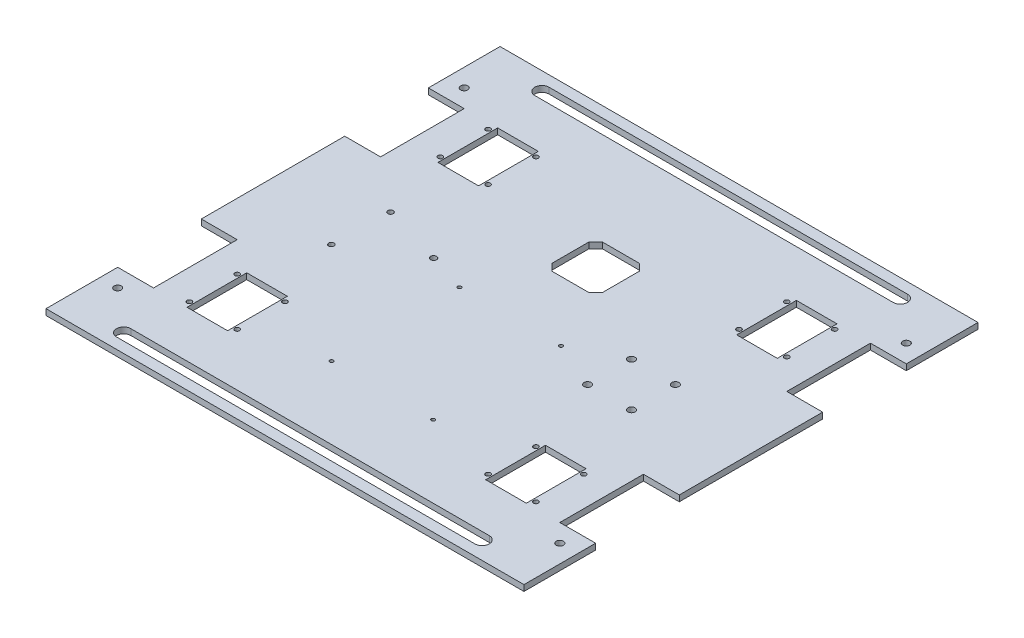
from build123d import *

# Parameters (mm, degrees)
SKETCH_1_W          = 400
SKETCH_1_H          = 380
EXTRUDE_1_DEPTH     = 5
SKETCH_2_R          = 2.25
SKETCH_2_R_2        = 2.5
SKETCH_2_R_3        = 3
SKETCH_2_R_4        = 2
SKETCH_2_R_5        = 1.5
SKETCH_2_W          = 30
SKETCH_2_H          = 70
SKETCH_2_W_2        = 34
SKETCH_2_H_2        = 50
CUT_EXTRUDE_1_DEPTH = 276.907593226


with BuildPart() as part:
    # 草圖1 → 填料-伸長1 (new body)
    with BuildSketch(Plane(origin=(0, 0, 0), x_dir=(1, 0, 0), z_dir=(0, 1, 0))):
        Rectangle(SKETCH_1_W, SKETCH_1_H)
    extrude(amount=EXTRUDE_1_DEPTH)

    # 草圖2 → 除料-伸長1 (cut, through all)
    with BuildSketch(Plane(origin=(0, 5, 0), x_dir=(1, 0, 0), z_dir=(0, 1, 0))):
        with Locations((-127.07, -24.13)):
            Circle(SKETCH_2_R)
        with Locations((-125.8, 24.13)):
            Circle(SKETCH_2_R)
        with Locations((-74.5, 8.89)):
            Circle(SKETCH_2_R_2)
        with Locations((-185, 145)):
            Circle(SKETCH_2_R_3)
        with Locations((185, 145)):
            Circle(SKETCH_2_R_3)
        with Locations((-185, -145)):
            Circle(SKETCH_2_R_3)
        with Locations((185, -145)):
            Circle(SKETCH_2_R_3)
        with Locations((81.65, 18.35)):
            Circle(SKETCH_2_R_3)
        with Locations((118.35, 18.35)):
            Circle(SKETCH_2_R_3)
        with Locations((81.65, -18.35)):
            Circle(SKETCH_2_R_3)
        with Locations((118.35, -18.35)):
            Circle(SKETCH_2_R_3)
        with Locations((-145, -85)):
            Circle(SKETCH_2_R_4)
        with Locations((-105, -85)):
            Circle(SKETCH_2_R_4)
        with Locations((-145, -125)):
            Circle(SKETCH_2_R_4)
        with Locations((-105, -125)):
            Circle(SKETCH_2_R_4)
        with Locations((105, -85)):
            Circle(SKETCH_2_R_4)
        with Locations((145, -85)):
            Circle(SKETCH_2_R_4)
        with Locations((105, -125)):
            Circle(SKETCH_2_R_4)
        with Locations((145, -125)):
            Circle(SKETCH_2_R_4)
        with Locations((-145, 125)):
            Circle(SKETCH_2_R_4)
        with Locations((-105, 125)):
            Circle(SKETCH_2_R_4)
        with Locations((-145, 85)):
            Circle(SKETCH_2_R_4)
        with Locations((-105, 85)):
            Circle(SKETCH_2_R_4)
        with Locations((105, 125)):
            Circle(SKETCH_2_R_4)
        with Locations((145, 125)):
            Circle(SKETCH_2_R_4)
        with Locations((105, 85)):
            Circle(SKETCH_2_R_4)
        with Locations((145, 85)):
            Circle(SKETCH_2_R_4)
        with Locations((-42.5, -1.5)):
            Circle(SKETCH_2_R_5)
        with Locations((42.5, -1.5)):
            Circle(SKETCH_2_R_5)
        with Locations((-42.5, -108.5)):
            Circle(SKETCH_2_R_5)
        with Locations((42.5, -108.5)):
            Circle(SKETCH_2_R_5)
        with Locations((185, -95)):
            Rectangle(SKETCH_2_W, SKETCH_2_H)
        with Locations((-185, 95)):
            Rectangle(SKETCH_2_W, SKETCH_2_H)
        with Locations((-185, -95)):
            Rectangle(SKETCH_2_W, SKETCH_2_H)
        with Locations((185, 95)):
            Rectangle(SKETCH_2_W, SKETCH_2_H)
        with Locations((-125, -105)):
            Rectangle(SKETCH_2_W_2, SKETCH_2_H_2)
        with Locations((125, -105)):
            Rectangle(SKETCH_2_W_2, SKETCH_2_H_2)
        with Locations((-125, 105)):
            Rectangle(SKETCH_2_W_2, SKETCH_2_H_2)
        with Locations((125, 105)):
            Rectangle(SKETCH_2_W_2, SKETCH_2_H_2)
        Polygon((-21.15, 85.5), (-15.5, 91.15), (15.5, 91.15), (21.15, 85.5), (21.15, 54.5), (15.5, 48.85), (-15.5, 48.85), (-21.15, 54.5), align=None)
        with BuildLine():
            Line((-214.88693476, -145), (-214.88693476, -175))
            ThreePointArc((-214.88693476, -175), (-234.88693476, -195), (-254.88693476, -175))
            Line((-254.88693476, -175), (-254.88693476, -145))
            ThreePointArc((-254.88693476, -145), (-234.88693476, -125), (-214.88693476, -145))
        make_face()
        with BuildLine():
            Line((-214.88693476, 145), (-214.88693476, 175))
            ThreePointArc((-214.88693476, 175), (-234.88693476, 195), (-254.88693476, 175))
            Line((-254.88693476, 175), (-254.88693476, 145))
            ThreePointArc((-254.88693476, 145), (-234.88693476, 125), (-214.88693476, 145))
        make_face()
        with BuildLine():
            Line((214.88693476, -145), (214.88693476, -175))
            ThreePointArc((214.88693476, -175), (234.88693476, -195), (254.88693476, -175))
            Line((254.88693476, -175), (254.88693476, -145))
            ThreePointArc((254.88693476, -145), (234.88693476, -125), (214.88693476, -145))
        make_face()
        with BuildLine():
            Line((214.88693476, 145), (214.88693476, 175))
            ThreePointArc((214.88693476, 175), (234.88693476, 195), (254.88693476, 175))
            Line((254.88693476, 175), (254.88693476, 145))
            ThreePointArc((254.88693476, 145), (234.88693476, 125), (214.88693476, 145))
        make_face()
        with BuildLine():
            Line((-150, 181), (150, 181))
            ThreePointArc((150, 181), (156, 175), (150, 169))
            Line((150, 169), (-150, 169))
            ThreePointArc((-150, 169), (-156, 175), (-150, 181))
        make_face()
        with BuildLine():
            Line((-150, -181), (150, -181))
            ThreePointArc((150, -181), (156, -175), (150, -169))
            Line((150, -169), (-150, -169))
            ThreePointArc((-150, -169), (-156, -175), (-150, -181))
        make_face()
    extrude(amount=-CUT_EXTRUDE_1_DEPTH, mode=Mode.SUBTRACT)


solid = part.part
